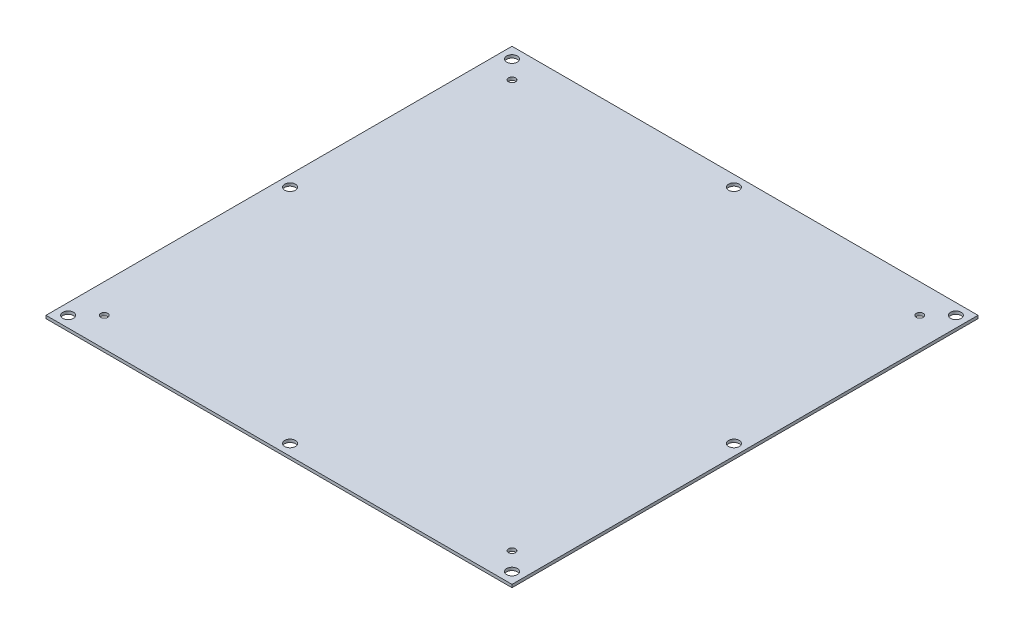
from build123d import *

# Parameters (mm, degrees)
SKETCH1_W            = 350
SKETCH1_H            = 347
BASE_FLANGE1_DEPTH   = 1.51892
M3_CLEARANCE_HOLE1_D = 3.6
M4_CLEARANCE_HOLE1_D = 4.8
SKETCH13_R           = 8.5
SKETCH13_R_2         = 1.375
CUT_EXTRUDE1_DEPTH   = 1.51892
SKETCH41_W           = 347
SKETCH41_H           = 1.51892
BOSS_EXTRUDE4_DEPTH  = 1.905
SKETCH42_W           = 347
SKETCH42_H           = 1.51892
BOSS_EXTRUDE5_DEPTH  = 1.905
CUT_EXTRUDE2_DEPTH   = 1.51892
BOSS_EXTRUDE6_DEPTH  = 1.51892
CLEARANCE_HOLE2_D    = 3.4
FILLET2_R            = 5
SKETCH50_OUTSIDE_W   = 455.91
SKETCH50_OUTSIDE_H   = 456.1
SKETCH50_OUTSIDE_W_2 = 240
SKETCH50_OUTSIDE_H_2 = 240
CUT_EXTRUDE3_DEPTH   = 1.51892
M5_CLEARANCE_HOLE1_D = 5.5


# Sheet-metal steps are written as plain solids
with BuildPart() as part:
    # Sketch1 → Base-Flange1 (new body)
    with BuildSketch(Plane(origin=(0, 0, 0), x_dir=(1, 0, 0), z_dir=(0, 1, 0))):
        with Locations((0, 13.5)):
            Rectangle(SKETCH1_W, SKETCH1_H)
    extrude(amount=-BASE_FLANGE1_DEPTH)

    # M3 Clearance Hole1 (through all)
    with Locations(Plane(origin=(0, 0, 0), x_dir=(1, 0, 0), z_dir=(0, 1, 0))):
        with Locations((-105, 105), (105, 105), (105, -105), (-105, -105)):
            Hole(M3_CLEARANCE_HOLE1_D / 2)

    # M4 Clearance Hole1 (through all)
    with Locations(Plane(origin=(0, -1.51892, 0), x_dir=(-1, 0, 0), z_dir=(0, -1, 0))):
        with Locations((167.5, 146.5), (167.5, 169), (-167.5, 146.5), (-167.5, 169), (-167.5, -149), (-167.5, -126.5), (167.5, -149), (167.5, -126.5)):
            Hole(M4_CLEARANCE_HOLE1_D / 2)

    # Sketch13 → Cut-Extrude1 (cut)
    with BuildSketch(Plane(origin=(0, 0, 0), x_dir=(1, 0, 0), z_dir=(0, 1, 0))):
        with Locations(Location((0, 170, 0), (0, 0, 270))):
            Circle(SKETCH13_R)
        with Locations(Location((-11.825, 170, 0), (0, 0, 270))):
            Circle(SKETCH13_R_2)
        with Locations(Location((11.825, 170, 0), (0, 0, 270))):
            Circle(SKETCH13_R_2)
    extrude(amount=-CUT_EXTRUDE1_DEPTH, mode=Mode.SUBTRACT)

    # Sketch41 → Boss-Extrude4 (add)
    with BuildSketch(Plane(origin=(175, 0, 0), x_dir=(0, 0, -1), z_dir=(1, 0, 0))):
        with Locations((13.5, -0.75946)):
            Rectangle(SKETCH41_W, SKETCH41_H)
    extrude(amount=BOSS_EXTRUDE4_DEPTH)

    # Sketch42 → Boss-Extrude5 (add)
    with BuildSketch(Plane.ZY.offset(175)):
        with Locations((-13.5, -0.75946)):
            Rectangle(SKETCH42_W, SKETCH42_H)
    extrude(amount=BOSS_EXTRUDE5_DEPTH)

    # Sketch43 → Cut-Extrude2 (cut)
    with BuildSketch(Plane(origin=(0, 0, 0), x_dir=(1, 0, 0), z_dir=(0, 1, 0))):
        Polygon((-176.905, -120), (-120, -63.095), (-120, 80.095), (-176.905, 137), align=None)
        Polygon((-156.905, 177), (-99.905, 120), (-42.952595893, 120), (-25, 187), (-176.905, 187), (-176.905, 177), align=None)
        Polygon((25, 187), (42.952595893, 120), (99.905, 120), (156.905, 177), (176.905, 177), (176.905, 187), align=None)
        Polygon((120, 80.095), (120, -63.095), (176.905, -120), (176.905, 137), align=None)
        Polygon((116.905, -120), (-116.905, -120), (-156.905, -160), (156.905, -160), align=None)
    extrude(amount=-CUT_EXTRUDE2_DEPTH, mode=Mode.SUBTRACT)

    # Sketch45 → Boss-Extrude6 (add)
    with BuildSketch(Plane(origin=(0, 0, 0), x_dir=(1, 0, 0), z_dir=(0, 1, 0))):
        Polygon((-25, 187), (-23.124355653, 194), (23.124355653, 194), (25, 187), align=None)
    extrude(amount=-BOSS_EXTRUDE6_DEPTH)

    # Clearance Hole2 (through all)
    with Locations(Plane(origin=(0, 0, 0), x_dir=(1, 0, 0), z_dir=(0, 1, 0))):
        with Locations((-9.525, 188), (9.525, 188)):
            Hole(CLEARANCE_HOLE2_D / 2)

    # Fillet2
    fillet2_edges = [part.edges().sort_by_distance(p)[0] for p in [
        (176.905, -0.75946, 160),
        (-176.905, -0.75946, 160),
        (176.905, -0.75946, -177),
        (42.952595893, -0.75946, -120),
        (99.905, -0.75946, -120),
        (156.905, -0.75946, -177),
        (176.905, -0.75946, 120),
        (176.905, -0.75946, -137),
        (120, -0.75946, -80.095),
        (120, -0.75946, 63.095),
        (-176.905, -0.75946, -137),
        (-176.905, -0.75946, 120),
        (-120, -0.75946, 63.095),
        (-120, -0.75946, -80.095),
        (-176.905, -0.75946, -177),
        (-156.905, -0.75946, -177),
        (-99.905, -0.75946, -120),
        (-42.952595893, -0.75946, -120),
        (-156.905, -0.75946, 160),
        (156.905, -0.75946, 160),
        (116.905, -0.75946, 120),
        (-116.905, -0.75946, 120),
        (-23.124355653, -0.75946, -194),
        (23.124355653, -0.75946, -194),
    ]]
    fillet(fillet2_edges, radius=FILLET2_R)

    # Sketch50 outside → Cut-Extrude3 (cut)
    with BuildSketch(Plane(origin=(0, 0, 0), x_dir=(1, 0, 0), z_dir=(0, 1, 0))):
        with Locations((0, 17)):
            Rectangle(SKETCH50_OUTSIDE_W, SKETCH50_OUTSIDE_H)
        Rectangle(SKETCH50_OUTSIDE_W_2, SKETCH50_OUTSIDE_H_2, mode=Mode.SUBTRACT)
    extrude(amount=-CUT_EXTRUDE3_DEPTH, mode=Mode.SUBTRACT)

    # M5 Clearance Hole1 (through all)
    with Locations(Plane(origin=(0, 0, 0), x_dir=(1, 0, 0), z_dir=(0, 1, 0))):
        with Locations((-114.3, 114.3), (114.3, 114.3), (114.3, -114.3), (-114.3, -114.3), (-114.3, 0), (0, 114.3), (114.3, 0), (0, -114.3)):
            Hole(M5_CLEARANCE_HOLE1_D / 2)


solid = part.part
